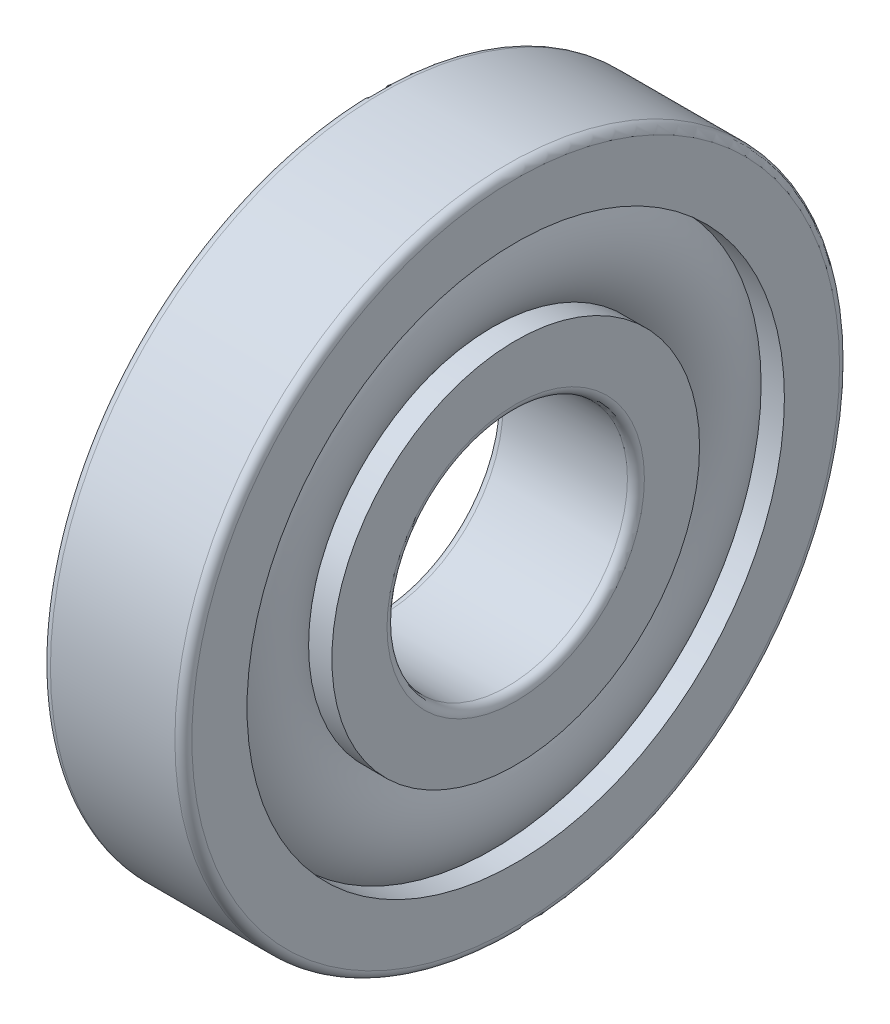
from build123d import *

# Parameters (mm, degrees)
CAGSPISKE_W     = 0.9
CAGSPISKE_H     = 1.5
CAGESPINE_ANGLE = 0.001
BALSIMSKE_R     = 4.5


with BuildPart() as part:
    # CagSpiSke → CageSpine (revolve)
    with BuildSketch(Plane.XY):
        with Locations((0, 16)):
            Rectangle(CAGSPISKE_W, CAGSPISKE_H)
    revolve(axis=Axis((-20.6375, 0, 0), (-1, 0, 0)), revolution_arc=CAGESPINE_ANGLE)

    # BalSimSke → BallsSimplified (revolve)
    with BuildSketch(Plane.XY):
        with Locations((0, 16)):
            Circle(BALSIMSKE_R)
    revolve(axis=Axis((-10, 0, 0), (1, 0, 0)))

    # InnRacSke → InnerRace (revolve)
    with BuildSketch(Plane.XY):
        with BuildLine():
            Line((-3.320485657, 13), (-5, 13))
            Line((-5, 13), (-5, 9.1))
            ThreePointArc((-5, 9.1), (-4.824264069, 8.675735931), (-4.4, 8.5))
            Line((-4.4, 8.5), (4.4, 8.5))
            ThreePointArc((4.4, 8.5), (4.824264069, 8.675735931), (5, 9.1))
            Line((5, 9.1), (5, 13))
            Line((5, 13), (3.320485657, 13))
            ThreePointArc((3.320485657, 13), (0, 11.525), (-3.320485657, 13))
        make_face()
    revolve(axis=Axis((-20.6375, 0, 0), (1, 0, 0)))

    # OutRacSke → OuterRace (revolve)
    with BuildSketch(Plane.XY):
        with BuildLine():
            Line((-3.320485657, 19), (-5, 19))
            Line((-5, 19), (-5, 22.9))
            ThreePointArc((-5, 22.9), (-4.824264069, 23.324264069), (-4.4, 23.5))
            Line((-4.4, 23.5), (4.4, 23.5))
            ThreePointArc((4.4, 23.5), (4.824264069, 23.324264069), (5, 22.9))
            Line((5, 22.9), (5, 19))
            Line((5, 19), (3.320485657, 19))
            ThreePointArc((3.320485657, 19), (0, 20.475), (-3.320485657, 19))
        make_face()
    revolve(axis=Axis((-20.6375, 0, 0), (1, 0, 0)))


solid = part.part
